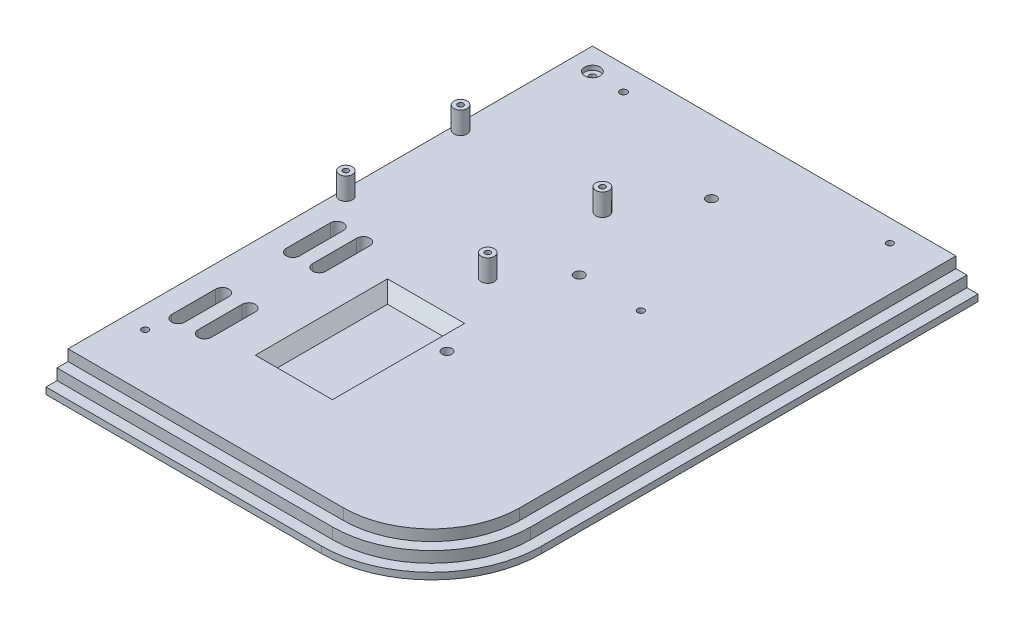
from build123d import *

# Parameters (mm, degrees)
SALIENTE_EXTRUIR1_DEPTH = 3
SALIENTE_EXTRUIR2_DEPTH = 5
SALIENTE_EXTRUIR3_DEPTH = 5
CROQUIS6_R              = 2.25
CORTAR_EXTRUIR3_DEPTH   = 5
CROQUIS7_R              = 1.5
CORTAR_EXTRUIR4_DEPTH   = 286.340147894
CORTAR_EXTRUIR5_DEPTH   = 8
CROQUIS9_R              = 1.5
CORTAR_EXTRUIR6_DEPTH   = 286.340147894
CROQUIS10_W             = 25
CROQUIS10_H             = 50
CORTAR_EXTRUIR7_DEPTH   = 5
CHAFL_N1_SIZE           = 5
CROQUIS13_R             = 3.5
CROQUIS13_R_2           = 2.25
SALIENTE_EXTRUIR4_DEPTH = 25
CROQUIS14_R             = 3
CROQUIS14_R_2           = 1.25
CROQUIS14_R_3           = 1.5
SALIENTE_EXTRUIR5_DEPTH = 10
CROQUIS12_R             = 1.6
CORTAR_EXTRUIR9_DEPTH   = 287.138078556
CROQUIS11_R             = 6
CORTAR_EXTRUIR8_DEPTH   = 5
CROQUIS16_W             = 40
CROQUIS16_H             = 8
CORTAR_EXTRUIR10_DEPTH  = 20
CORTAR_EXTRUIR11_DEPTH  = 30
CROQUIS19_R             = 1.5
CORTAR_EXTRUIR12_DEPTH  = 70
CROQUIS20_W             = 20
CROQUIS20_H             = 7.5
CORTAR_EXTRUIR13_DEPTH  = 20
CROQUIS21_W             = 20
CROQUIS21_H             = 7.5
CORTAR_EXTRUIR14_DEPTH  = 20
CROQUIS22_R             = 26
CROQUIS22_R_2           = 25
CORTAR_EXTRUIR15_DEPTH  = 6
CROQUIS23_R             = 3.5
CORTAR_EXTRUIR16_DEPTH  = 2


with BuildPart() as part:
    # Croquis1 → Saliente-Extruir1 (new body)
    with BuildSketch(Plane(origin=(0, 0, 0), x_dir=(1, 0, 0), z_dir=(0, 1, 0))):
        with BuildLine():
            Line((125, 225), (-125, 225))
            ThreePointArc((-125, 225), (-160.355339059, 210.355339059), (-175, 175))
            Line((-175, 175), (-175, -175))
            ThreePointArc((-175, -175), (-160.355339059, -210.355339059), (-125, -225))
            Line((-125, -225), (125, -225))
            ThreePointArc((125, -225), (160.355339059, -210.355339059), (175, -175))
            Line((175, -175), (175, 175))
            ThreePointArc((175, 175), (160.355339059, 210.355339059), (125, 225))
        make_face()
    extrude(amount=SALIENTE_EXTRUIR1_DEPTH)

    # Croquis2 → Saliente-Extruir2 (add)
    with BuildSketch(Plane(origin=(0, 3, 0), x_dir=(1, 0, 0), z_dir=(0, 1, 0))):
        with BuildLine():
            Line((-125, -220), (125, -220))
            ThreePointArc((125, -220), (156.819805153, -206.819805153), (170, -175))
            Line((170, -175), (170, 175))
            ThreePointArc((170, 175), (156.819805153, 206.819805153), (125, 220))
            Line((125, 220), (-125, 220))
            ThreePointArc((-125, 220), (-156.819805153, 206.819805153), (-170, 175))
            Line((-170, 175), (-170, -175))
            ThreePointArc((-170, -175), (-156.819805153, -206.819805153), (-125, -220))
        make_face()
    extrude(amount=SALIENTE_EXTRUIR2_DEPTH)

    # Croquis3 → Saliente-Extruir3 (add)
    with BuildSketch(Plane(origin=(0, 8, 0), x_dir=(1, 0, 0), z_dir=(0, 1, 0))):
        with BuildLine():
            Line((-125, -215), (125, -215))
            ThreePointArc((125, -215), (153.284271247, -203.284271247), (165, -175))
            Line((165, -175), (165, 175))
            ThreePointArc((165, 175), (153.284271247, 203.284271247), (125, 215))
            Line((125, 215), (-125, 215))
            ThreePointArc((-125, 215), (-153.284271247, 203.284271247), (-165, 175))
            Line((-165, 175), (-165, -175))
            ThreePointArc((-165, -175), (-153.284271247, -203.284271247), (-125, -215))
        make_face()
    extrude(amount=SALIENTE_EXTRUIR3_DEPTH)

    # Croquis6 → Cortar-Extruir3 (cut)
    with BuildSketch(Plane(origin=(0, 13, 0), x_dir=(1, 0, 0), z_dir=(0, 1, 0))):
        with Locations(Location((-87, -130, 0), (0, 0, 270))):
            Circle(CROQUIS6_R)
        with Locations(Location((-87, -70, 0), (0, 0, 270))):
            Circle(CROQUIS6_R)
        with Locations(Location((-87, -10, 0), (0, 0, 270))):
            Circle(CROQUIS6_R)
        with Locations(Location((87, -130, 0), (0, 0, 90))):
            Circle(CROQUIS6_R)
        with Locations(Location((87, -70, 0), (0, 0, 90))):
            Circle(CROQUIS6_R)
        with Locations(Location((87, -10, 0), (0, 0, 90))):
            Circle(CROQUIS6_R)
    extrude(amount=-CORTAR_EXTRUIR3_DEPTH, mode=Mode.SUBTRACT)

    # Croquis7 → Cortar-Extruir4 (cut, through all)
    with BuildSketch(Plane(origin=(0, 13, 0), x_dir=(1, 0, 0), z_dir=(0, 1, 0))):
        with Locations(Location((-115, -70, 0), (0, 0, 270))):
            Circle(CROQUIS7_R)
        with Locations(Location((-115, 130, 0), (0, 0, 270))):
            Circle(CROQUIS7_R)
        with Locations(Location((115, -70, 0), (0, 0, 90))):
            Circle(CROQUIS7_R)
        with Locations(Location((115, 130, 0), (0, 0, 90))):
            Circle(CROQUIS7_R)
    extrude(amount=-CORTAR_EXTRUIR4_DEPTH, mode=Mode.SUBTRACT)

    # Croquis8 → Cortar-Extruir5 (cut)
    with BuildSketch(Plane(origin=(0, 13, 0), x_dir=(1, 0, 0), z_dir=(0, 1, 0))):
        with BuildLine():
            Line((16.014653583, -158), (16.014653583, -178))
            ThreePointArc((16.014653583, -178), (13.014653583, -181), (10.014653583, -178))
            Line((10.014653583, -178), (10.014653583, -158))
            ThreePointArc((10.014653583, -158), (13.014653583, -155), (16.014653583, -158))
        make_face()
        with BuildLine():
            Line((28.014653583, -158), (28.014653583, -178))
            ThreePointArc((28.014653583, -178), (25.014653583, -181), (22.014653583, -178))
            Line((22.014653583, -178), (22.014653583, -158))
            ThreePointArc((22.014653583, -158), (25.014653583, -155), (28.014653583, -158))
        make_face()
        with BuildLine():
            Line((28.014653583, -106), (28.014653583, -126))
            ThreePointArc((28.014653583, -126), (25.014653583, -129), (22.014653583, -126))
            Line((22.014653583, -126), (22.014653583, -106))
            ThreePointArc((22.014653583, -106), (25.014653583, -103), (28.014653583, -106))
        make_face()
        with BuildLine():
            Line((16.014653583, -106), (16.014653583, -126))
            ThreePointArc((16.014653583, -126), (13.014653583, -129), (10.014653583, -126))
            Line((10.014653583, -126), (10.014653583, -106))
            ThreePointArc((10.014653583, -106), (13.014653583, -103), (16.014653583, -106))
        make_face()
    extrude(amount=-CORTAR_EXTRUIR5_DEPTH, mode=Mode.SUBTRACT)

    # Croquis9 → Cortar-Extruir6 (cut, through all)
    with BuildSketch(Plane(origin=(0, 13, 0), x_dir=(1, 0, 0), z_dir=(0, 1, 0))):
        with Locations(Location((13.014653583, -168, 0), (0, 0, 270))):
            Circle(CROQUIS9_R)
        with Locations(Location((25.014653583, -168, 0), (0, 0, 270))):
            Circle(CROQUIS9_R)
        with Locations(Location((13.014653583, -116, 0), (0, 0, 270))):
            Circle(CROQUIS9_R)
        with Locations(Location((25.014653583, -116, 0), (0, 0, 270))):
            Circle(CROQUIS9_R)
        with Locations(Location((-87, -130, 0), (0, 0, 270))):
            Circle(CROQUIS9_R)
        with Locations(Location((-87, -70, 0), (0, 0, 270))):
            Circle(CROQUIS9_R)
        with Locations(Location((-87, -10, 0), (0, 0, 270))):
            Circle(CROQUIS9_R)
        with Locations(Location((87, -10, 0), (0, 0, 270))):
            Circle(CROQUIS9_R)
        with Locations(Location((87, -70, 0), (0, 0, 270))):
            Circle(CROQUIS9_R)
        with Locations(Location((87, -130, 0), (0, 0, 270))):
            Circle(CROQUIS9_R)
    extrude(amount=-CORTAR_EXTRUIR6_DEPTH, mode=Mode.SUBTRACT)

    # Croquis10 → Cortar-Extruir7 (cut)
    with BuildSketch(Plane(origin=(0, 13, 0), x_dir=(1, 0, 0), z_dir=(0, 1, 0))):
        with Locations((62.5, -145)):
            Rectangle(CROQUIS10_W, CROQUIS10_H)
    extrude(amount=-CORTAR_EXTRUIR7_DEPTH, mode=Mode.SUBTRACT)

    # Chaflán1
    chafl_n1_edges = [part.edges().sort_by_distance(p)[0] for p in [
        (62.5, 13, 120),
        (50, 13, 145),
        (62.5, 13, 170),
        (75, 13, 145),
    ]]
    chamfer(chafl_n1_edges, length=CHAFL_N1_SIZE - 0.0001)  # a hair under: the kernel refuses the full size

    # Croquis13 → Saliente-Extruir4 (add)
    # profile 1 of 4: a face of its own
    with BuildSketch(Plane(origin=(0, 13, 0), x_dir=(1, 0, 0), z_dir=(0, 1, 0))):
        with Locations(Location((-20, -50, 0), (0, 0, 270))):
            Circle(CROQUIS13_R)
        with Locations(Location((-20, -50, 0), (0, 0, 270))):
            Circle(CROQUIS13_R_2, mode=Mode.SUBTRACT)
    # profile 2 of 4: a face of its own
    with BuildSketch(Plane(origin=(0, 13, 0), x_dir=(1, 0, 0), z_dir=(0, 1, 0))):
        with Locations(Location((-60, -50, 0), (0, 0, 270))):
            Circle(CROQUIS13_R)
        with Locations(Location((-60, -50, 0), (0, 0, 270))):
            Circle(CROQUIS13_R_2, mode=Mode.SUBTRACT)
    # profile 3 of 4: a face of its own
    with BuildSketch(Plane(origin=(0, 13, 0), x_dir=(1, 0, 0), z_dir=(0, 1, 0))):
        with Locations(Location((-60, -90, 0), (0, 0, 270))):
            Circle(CROQUIS13_R)
        with Locations(Location((-60, -90, 0), (0, 0, 270))):
            Circle(CROQUIS13_R_2, mode=Mode.SUBTRACT)
    # profile 4 of 4: a face of its own
    with BuildSketch(Plane(origin=(0, 13, 0), x_dir=(1, 0, 0), z_dir=(0, 1, 0))):
        with Locations(Location((-20, -90, 0), (0, 0, 270))):
            Circle(CROQUIS13_R)
        with Locations(Location((-20, -90, 0), (0, 0, 270))):
            Circle(CROQUIS13_R_2, mode=Mode.SUBTRACT)
    extrude(amount=SALIENTE_EXTRUIR4_DEPTH)

    # Croquis14 → Saliente-Extruir5 (add)
    # profile 1 of 6: a face of its own
    with BuildSketch(Plane(origin=(0, 13, 0), x_dir=(1, 0, 0), z_dir=(0, 1, 0))):
        with Locations(Location((67.55, -40, 0), (0, 0, 270))):
            Circle(CROQUIS14_R)
        with Locations(Location((67.55, -40, 0), (0, 0, 270))):
            Circle(CROQUIS14_R_2, mode=Mode.SUBTRACT)
    # profile 2 of 6: a face of its own
    with BuildSketch(Plane(origin=(0, 13, 0), x_dir=(1, 0, 0), z_dir=(0, 1, 0))):
        with Locations(Location((3.15, -40, 0), (0, 0, 270))):
            Circle(CROQUIS14_R)
        with Locations(Location((3.15, -40, 0), (0, 0, 270))):
            Circle(CROQUIS14_R_2, mode=Mode.SUBTRACT)
    # profile 3 of 6: a face of its own
    with BuildSketch(Plane(origin=(0, 13, 0), x_dir=(1, 0, 0), z_dir=(0, 1, 0))):
        with Locations(Location((3, -91.9, 0), (0, 0, 270))):
            Circle(CROQUIS14_R)
        with Locations(Location((3, -91.9, 0), (0, 0, 270))):
            Circle(CROQUIS14_R_2, mode=Mode.SUBTRACT)
    # profile 4 of 6: a face of its own
    with BuildSketch(Plane(origin=(0, 13, 0), x_dir=(1, 0, 0), z_dir=(0, 1, 0))):
        with Locations(Location((67.4, -91.9, 0), (0, 0, 270))):
            Circle(CROQUIS14_R)
        with Locations(Location((67.4, -91.9, 0), (0, 0, 270))):
            Circle(CROQUIS14_R_2, mode=Mode.SUBTRACT)
    # profile 5 of 6: a face of its own
    with BuildSketch(Plane(origin=(0, 13, 0), x_dir=(1, 0, 0), z_dir=(0, 1, 0))):
        with Locations(Location((-10, -102.9, 0), (0, 0, 270))):
            Circle(CROQUIS14_R)
        with Locations(Location((-10, -102.9, 0), (0, 0, 270))):
            Circle(CROQUIS14_R_3, mode=Mode.SUBTRACT)
    # profile 6 of 6: a face of its own
    with BuildSketch(Plane(origin=(0, 13, 0), x_dir=(1, 0, 0), z_dir=(0, 1, 0))):
        with Locations(Location((-10, -118.108484849, 0), (0, 0, 270))):
            Circle(CROQUIS14_R)
        with Locations(Location((-10, -118.108484849, 0), (0, 0, 270))):
            Circle(CROQUIS14_R_3, mode=Mode.SUBTRACT)
    extrude(amount=SALIENTE_EXTRUIR5_DEPTH)

    # Croquis12 → Cortar-Extruir9 (cut, through all)
    with BuildSketch(Plane(origin=(0, 13, 0), x_dir=(1, 0, 0), z_dir=(0, 1, 0))):
        with Locations(Location((-25.1, 162.2, 0), (0, 0, 270))):
            Circle(CROQUIS12_R)
        with Locations(Location((25.1, 162.2, 0), (0, 0, 270))):
            Circle(CROQUIS12_R)
        with Locations(Location((-25.1, 12, 0), (0, 0, 270))):
            Circle(CROQUIS12_R)
        with Locations(Location((25.1, 12, 0), (0, 0, 270))):
            Circle(CROQUIS12_R)
    extrude(amount=-CORTAR_EXTRUIR9_DEPTH, mode=Mode.SUBTRACT)

    # Croquis11 → Cortar-Extruir8 (cut)
    with BuildSketch(Plane.XZ):
        with Locations(Location((87, 130, 0), (0, 0, 270))):
            Circle(CROQUIS11_R)
        with Locations(Location((87, 70, 0), (0, 0, 270))):
            Circle(CROQUIS11_R)
        with Locations(Location((87, 10, 0), (0, 0, 270))):
            Circle(CROQUIS11_R)
        with Locations(Location((-87, 10, 0), (0, 0, 270))):
            Circle(CROQUIS11_R)
        with Locations(Location((-87, 70, 0), (0, 0, 270))):
            Circle(CROQUIS11_R)
        with Locations(Location((-87, 130, 0), (0, 0, 270))):
            Circle(CROQUIS11_R)
        with Locations(Location((-115, 70, 0), (0, 0, 270))):
            Circle(CROQUIS11_R)
        with Locations(Location((115, 70, 0), (0, 0, 270))):
            Circle(CROQUIS11_R)
        with Locations(Location((115, -130, 0), (0, 0, 270))):
            Circle(CROQUIS11_R)
        with Locations(Location((-115, -130, 0), (0, 0, 270))):
            Circle(CROQUIS11_R)
        with Locations(Location((-25.1, -162.2, 0), (0, 0, 270))):
            Circle(CROQUIS11_R)
        with Locations(Location((25.1, -162.2, 0), (0, 0, 270))):
            Circle(CROQUIS11_R)
        with Locations(Location((-25.1, -12, 0), (0, 0, 270))):
            Circle(CROQUIS11_R)
        with Locations(Location((25.1, -12, 0), (0, 0, 270))):
            Circle(CROQUIS11_R)
        with BuildLine():
            Line((13.014653583, 188), (25.014653583, 188))
            ThreePointArc((25.014653583, 188), (45.014653583, 168), (25.014653583, 148))
            Line((25.014653583, 148), (13.014653583, 148))
            ThreePointArc((13.014653583, 148), (-6.985346417, 168), (13.014653583, 188))
        make_face()
        with BuildLine():
            Line((13.014653583, 136), (25.014653583, 136))
            ThreePointArc((25.014653583, 136), (45.014653583, 116), (25.014653583, 96))
            Line((25.014653583, 96), (13.014653583, 96))
            ThreePointArc((13.014653583, 96), (-6.985346417, 116), (13.014653583, 136))
        make_face()
    extrude(amount=-CORTAR_EXTRUIR8_DEPTH, mode=Mode.SUBTRACT)

    # Croquis16 → Cortar-Extruir10 (cut, symmetric)
    with BuildSketch(Plane(origin=(0, 0, 0), x_dir=(0, 0, -1), z_dir=(1, 0, 0))):
        with Locations((22, 4)):
            Rectangle(CROQUIS16_W, CROQUIS16_H)
    extrude(amount=CORTAR_EXTRUIR10_DEPTH, both=True, mode=Mode.SUBTRACT)

    # Croquis17 → Cortar-Extruir11 (cut, symmetric)
    with BuildSketch(Plane(origin=(0, 13, 0), x_dir=(1, 0, 0), z_dir=(0, 1, 0))):
        Polygon((0, 23), (0, -225), (-175, -225), (-175, 23), (-175, 225), (175, 225), (175, 23), align=None)
    extrude(amount=CORTAR_EXTRUIR11_DEPTH, both=True, mode=Mode.SUBTRACT)

    # Croquis19 → Cortar-Extruir12 (cut)
    with BuildSketch(Plane(origin=(0, 13, 0), x_dir=(1, 0, 0), z_dir=(0, 1, 0))):
        with Locations(Location((10, 13, 0), (0, 0, 270))):
            Circle(CROQUIS19_R)
        with Locations(Location((10, -190, 0), (0, 0, 270))):
            Circle(CROQUIS19_R)
        with Locations(Location((145, 13, 0), (0, 0, 270))):
            Circle(CROQUIS19_R)
    extrude(amount=-CORTAR_EXTRUIR12_DEPTH, mode=Mode.SUBTRACT)

    # Croquis20 → Cortar-Extruir13 (cut)
    with BuildSketch(Plane.ZY):
        with Locations((190, 3.75)):
            Rectangle(CROQUIS20_W, CROQUIS20_H)
    extrude(amount=-CORTAR_EXTRUIR13_DEPTH, mode=Mode.SUBTRACT)

    # Croquis21 → Cortar-Extruir14 (cut)
    with BuildSketch(Plane(origin=(0, 0, -23), x_dir=(-1, 0, 0), z_dir=(0, 0, -1))):
        with Locations((-145, 3.75)):
            Rectangle(CROQUIS21_W, CROQUIS21_H)
    extrude(amount=-CORTAR_EXTRUIR14_DEPTH, mode=Mode.SUBTRACT)

    # Croquis22 → Cortar-Extruir15 (cut)
    with BuildSketch(Plane.XZ):
        with BuildLine():
            Line((7, 5), (27, 5))
            Line((27, 5), (27, 0.860404348))
            ThreePointArc((27, 0.860404348), (36.144078039, -5.142278784), (37.469316877, -16))
            Line((37.469316877, -16), (128, -16))
            Line((128, -16), (128, 4))
            Line((128, 4), (162, 4))
            Line((162, 4), (162, -16))
            Line((162, -16), (168, -16))
            Line((168, -16), (168, 175))
            ThreePointArc((168, 175), (155.405591591, 205.405591591), (125, 218))
            Line((125, 218), (7, 218))
            Line((7, 218), (7, 207))
            Line((7, 207), (27, 207))
            Line((27, 207), (27, 194.926908467))
            ThreePointArc((27, 194.926908467), (51.880553533, 170.687642068), (32.294763473, 142))
            ThreePointArc((32.294763473, 142), (51.763485333, 112.325765386), (25.014653583, 89))
            Line((25.014653583, 89), (13.014653583, 89))
            ThreePointArc((13.014653583, 89), (9.988255003, 89.17014887), (7, 89.67845099))
            Line((7, 89.67845099), (7, 5))
        make_face()
        with Locations(Location((87, 130, 0), (0, 0, 270))):
            Circle(CROQUIS22_R, mode=Mode.SUBTRACT)
        with Locations(Location((87, 10, 0), (0, 0, 270))):
            Circle(CROQUIS22_R_2, mode=Mode.SUBTRACT)
        with BuildLine():
            ThreePointArc((108.5, 84.620191517), (61, 70), (108.5, 55.379808483))
            ThreePointArc((108.5, 55.379808483), (131, 70), (108.5, 84.620191517))
        make_face(mode=Mode.SUBTRACT)
    extrude(amount=-CORTAR_EXTRUIR15_DEPTH, mode=Mode.SUBTRACT)

    # Croquis23 → Cortar-Extruir16 (cut)
    with BuildSketch(Plane(origin=(0, 13, 0), x_dir=(1, 0, 0), z_dir=(0, 1, 0))):
        with Locations(Location((10, 13, 0), (0, 0, 270))):
            Circle(CROQUIS23_R)
    extrude(amount=-CORTAR_EXTRUIR16_DEPTH, mode=Mode.SUBTRACT)


solid = part.part
